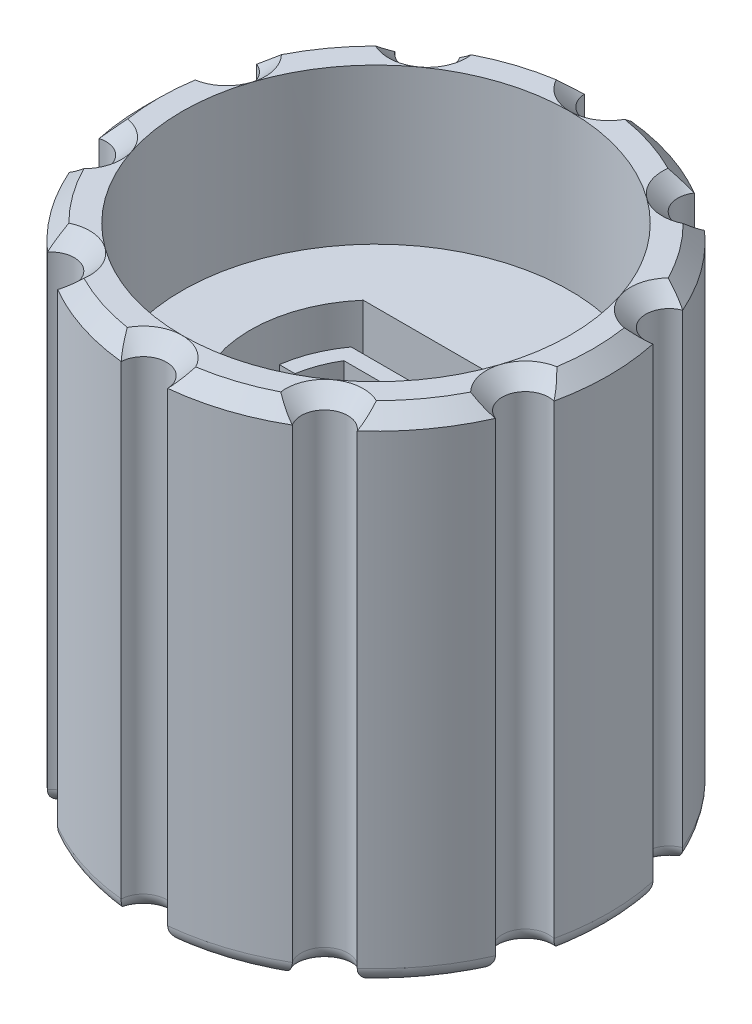
from build123d import *

# Parameters (mm, degrees)
SKETCH1_R           = 7.5
BOSS_EXTRUDE1_DEPTH = 16
CUT_EXTRUDE3_DEPTH  = 20.19635382
CHAMFER1_SIZE       = 0.5
FILLET1_R           = 0.5
CUT_EXTRUDE4_DEPTH  = 14
BOSS_EXTRUDE2_DEPTH = 8
SKETCH7_R           = 6.25
CUT_EXTRUDE5_DEPTH  = 5


with BuildPart() as part:
    # Sketch1 → Boss-Extrude1 (new body)
    with BuildSketch(Plane(origin=(0, 0, 0), x_dir=(1, 0, 0), z_dir=(0, 1, 0))):
        Circle(SKETCH1_R)
    extrude(amount=BOSS_EXTRUDE1_DEPTH)

    # Sketch4 → Cut-Extrude3 (cut, through all)
    with BuildSketch(Plane(origin=(0, 16, 0), x_dir=(1, 0, 0), z_dir=(0, 1, 0))):
        with BuildLine():
            ThreePointArc((-0.749061913, -7.4625), (0, -7.5), (0.749061913, -7.4625))
            ThreePointArc((0.749061913, -7.4625), (0, -6.75), (-0.749061913, -7.4625))
        make_face()
        with BuildLine():
            ThreePointArc((4.992351263, -5.597001775), (3.967550453, -5.460864712), (3.780343628, -6.477576866))
            ThreePointArc((3.780343628, -6.477576866), (4.408389392, -6.067627458), (4.992351263, -5.597001775))
        make_face()
        with BuildLine():
            ThreePointArc((-4.992351263, -5.597001775), (-4.408389392, -6.067627458), (-3.780343628, -6.477576866))
            ThreePointArc((-3.780343628, -6.477576866), (-3.967550453, -5.460864712), (-4.992351263, -5.597001775))
        make_face()
        with BuildLine():
            ThreePointArc((7.328732114, -1.593639107), (6.419631485, -2.085864712), (6.865786392, -3.018439534))
            ThreePointArc((6.865786392, -3.018439534), (7.132923872, -2.317627458), (7.328732114, -1.593639107))
        make_face()
        with BuildLine():
            ThreePointArc((-7.328732114, -1.593639107), (-7.132923872, -2.317627458), (-6.865786392, -3.018439534))
            ThreePointArc((-6.865786392, -3.018439534), (-6.419631485, -2.085864712), (-7.328732114, -1.593639107))
        make_face()
        with BuildLine():
            ThreePointArc((-6.865786392, 3.018439534), (-7.132923872, 2.317627458), (-7.328732114, 1.593639107))
            ThreePointArc((-7.328732114, 1.593639107), (-6.419631485, 2.085864712), (-6.865786392, 3.018439534))
        make_face()
        with BuildLine():
            ThreePointArc((6.865786392, 3.018439534), (6.419631485, 2.085864712), (7.328732114, 1.593639107))
            ThreePointArc((7.328732114, 1.593639107), (7.132923872, 2.317627458), (6.865786392, 3.018439534))
        make_face()
        with BuildLine():
            ThreePointArc((-3.780343628, 6.477576866), (-4.408389392, 6.067627458), (-4.992351263, 5.597001775))
            ThreePointArc((-4.992351263, 5.597001775), (-3.967550453, 5.460864712), (-3.780343628, 6.477576866))
        make_face()
        with BuildLine():
            ThreePointArc((3.780343628, 6.477576866), (3.967550453, 5.460864712), (4.992351263, 5.597001775))
            ThreePointArc((4.992351263, 5.597001775), (4.408389392, 6.067627458), (3.780343628, 6.477576866))
        make_face()
        with BuildLine():
            ThreePointArc((0.749061913, 7.4625), (0, 7.5), (-0.749061913, 7.4625))
            ThreePointArc((-0.749061913, 7.4625), (0, 6.75), (0.749061913, 7.4625))
        make_face()
    extrude(amount=-CUT_EXTRUDE3_DEPTH, mode=Mode.SUBTRACT)

    # Chamfer1
    chamfer1_edges = [part.edges().sort_by_distance(p)[0] for p in [
        (-3.967550453, 16, 5.460864712),
        (-6.067627458, 16, 4.408389392),
        (-6.419631485, 16, 2.085864712),
        (-7.5, 16, 0),
        (-6.419631485, 16, -2.085864712),
        (-6.067627458, 16, -4.408389392),
        (-3.967550453, 16, -5.460864712),
        (-2.317627458, 16, -7.132923872),
        (0, 16, -6.75),
        (2.317627458, 16, -7.132923872),
        (3.967550453, 16, -5.460864712),
        (6.067627458, 16, -4.408389392),
        (6.419631485, 16, -2.085864712),
        (7.5, 16, 0),
        (6.419631485, 16, 2.085864712),
        (6.067627458, 16, 4.408389392),
        (3.967550453, 16, 5.460864712),
        (2.317627458, 16, 7.132923872),
        (0, 16, 6.75),
        (-2.317627458, 16, 7.132923872),
    ]]
    chamfer(chamfer1_edges, length=CHAMFER1_SIZE)

    # Fillet1
    fillet1_edges = [part.edges().sort_by_distance(p)[0] for p in [
        (-3.967550453, 0, 5.460864712),
        (-2.317627458, 0, 7.132923872),
        (0, 0, 6.75),
        (2.317627458, 0, 7.132923872),
        (3.967550453, 0, 5.460864712),
        (6.067627458, 0, 4.408389392),
        (6.419631485, 0, 2.085864712),
        (7.5, 0, 0),
        (6.419631485, 0, -2.085864712),
        (6.067627458, 0, -4.408389392),
        (3.967550453, 0, -5.460864712),
        (2.317627458, 0, -7.132923872),
        (0, 0, -6.75),
        (-2.317627458, 0, -7.132923872),
        (-3.967550453, 0, -5.460864712),
        (-6.067627458, 0, -4.408389392),
        (-6.419631485, 0, -2.085864712),
        (-7.5, 0, 0),
        (-6.419631485, 0, 2.085864712),
        (-6.067627458, 0, 4.408389392),
    ]]
    fillet(fillet1_edges, radius=FILLET1_R)

    # Sketch5 → Cut-Extrude4 (cut)
    with BuildSketch(Plane(origin=(0, 16, 0), x_dir=(1, 0, 0), z_dir=(0, 1, 0))):
        with BuildLine():
            Line((-3.062678566, 2.65), (3.062678566, 2.65))
            ThreePointArc((3.062678566, 2.65), (0, -4.05), (-3.062678566, 2.65))
        make_face()
    extrude(amount=-CUT_EXTRUDE4_DEPTH, mode=Mode.SUBTRACT)

    # Sketch6 → Boss-Extrude2 (add)
    with BuildSketch(Plane(origin=(0, 2, 0), x_dir=(1, 0, 0), z_dir=(0, 1, 0))):
        with BuildLine():
            Line((2.949576241, 2.15), (-2.949576241, 2.15))
            ThreePointArc((-2.949576241, 2.15), (-3.384668522, 1.366206058), (-3.615591238, 0.5))
            Line((-3.615591238, 0.5), (-3.110064308, 0.5))
            ThreePointArc((-3.110064308, 0.5), (-2.953191346, 1.095974852), (-2.683281573, 1.65))
            Line((-2.683281573, 1.65), (2.683281573, 1.65))
            ThreePointArc((2.683281573, 1.65), (2.953191346, 1.095974852), (3.110064308, 0.5))
            Line((3.110064308, 0.5), (3.615591238, 0.5))
            ThreePointArc((3.615591238, 0.5), (3.384668522, 1.366206058), (2.949576241, 2.15))
        make_face()
        with BuildLine():
            Line((-3.65, 0), (-3.15, 0))
            ThreePointArc((-3.15, 0), (0, -3.15), (3.15, 0))
            Line((3.15, 0), (3.65, 0))
            ThreePointArc((3.65, 0), (0, -3.65), (-3.65, 0))
        make_face()
    extrude(amount=BOSS_EXTRUDE2_DEPTH)

    # Sketch7 → Cut-Extrude5 (cut)
    with BuildSketch(Plane(origin=(0, 16, 0), x_dir=(1, 0, 0), z_dir=(0, 1, 0))):
        Circle(SKETCH7_R)
        with BuildLine():
            Line((3.062678566, 2.65), (-3.062678566, 2.65))
            ThreePointArc((-3.062678566, 2.65), (0, -4.05), (3.062678566, 2.65))
        make_face(mode=Mode.SUBTRACT)
    extrude(amount=-CUT_EXTRUDE5_DEPTH, mode=Mode.SUBTRACT)


solid = part.part
